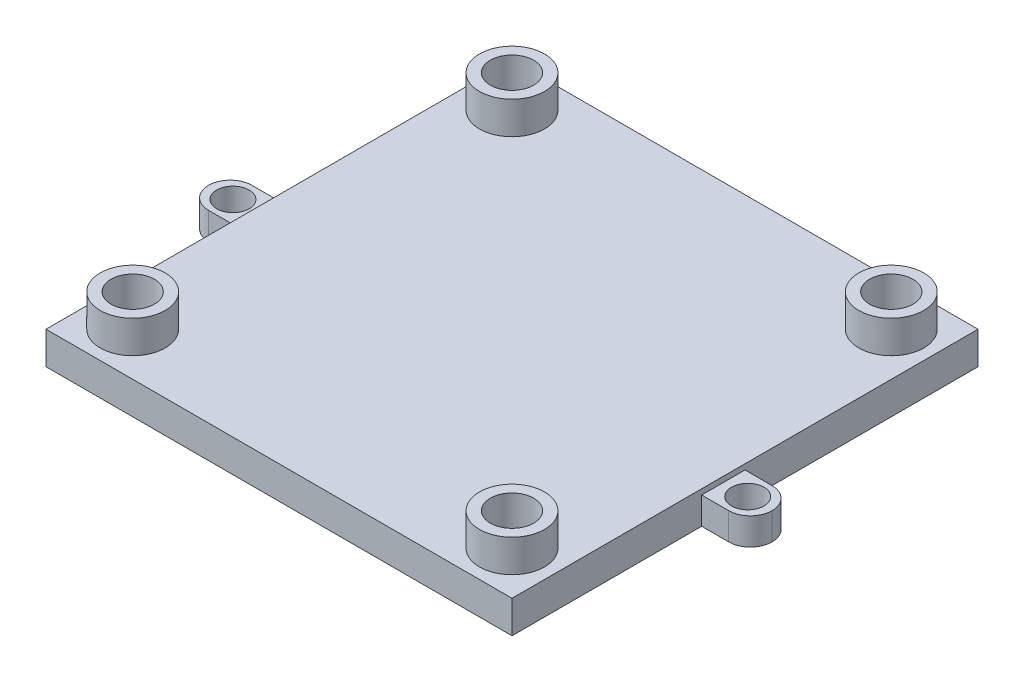
from build123d import *

# Parameters (mm, degrees)
SKETCH1_W            = 43
SKETCH1_H            = 43
BOSS_EXTRUDE1_DEPTH  = 3
SKETCH2_R            = 3
SKETCH2_R_2          = 2
BOSS_EXTRUDE5_DEPTH  = 3
SKETCH2_9_R          = 3
SKETCH2_9_R_2        = 2
BOSS_EXTRUDE6_DEPTH  = 3
SKETCH2_10_R         = 3
SKETCH2_10_R_2       = 2
BOSS_EXTRUDE7_DEPTH  = 3
SKETCH2_11_R         = 3
SKETCH2_11_R_2       = 2
BOSS_EXTRUDE8_DEPTH  = 3
SKETCH3_W            = 4.5
SKETCH3_H            = 4
SKETCH3_R            = 1.5
BOSS_EXTRUDE9_DEPTH  = 2.5
FILLET2_R            = 2
SKETCH4_W            = 4.5
SKETCH4_H            = 4
SKETCH4_R            = 1.5
BOSS_EXTRUDE10_DEPTH = 2.5
FILLET3_R            = 2
SKETCH7_R            = 2
CUT_EXTRUDE1_DEPTH   = 65.142419661
SKETCH2_13_R         = 2
CUT_EXTRUDE2_DEPTH   = 65.142419661
SKETCH2_14_R         = 2
CUT_EXTRUDE3_DEPTH   = 65.142419661


with BuildPart() as part:
    # Sketch1 → Boss-Extrude1 (new body)
    with BuildSketch(Plane(origin=(0, 0, 0), x_dir=(1, 0, 0), z_dir=(0, 1, 0))):
        with Locations((21.5, 21.5)):
            Rectangle(SKETCH1_W, SKETCH1_H)
    extrude(amount=BOSS_EXTRUDE1_DEPTH)

    # Sketch2 → Boss-Extrude5 (add)
    with BuildSketch(Plane(origin=(0, 3, 0), x_dir=(1, 0, 0), z_dir=(0, 1, 0))):
        with Locations(Location((4, 39, 0), (0, 0, 90))):
            Circle(SKETCH2_R)
        with Locations(Location((4, 39, 0), (0, 0, 270))):
            Circle(SKETCH2_R_2, mode=Mode.SUBTRACT)
    extrude(amount=BOSS_EXTRUDE5_DEPTH)

    # Sketch2<9> → Boss-Extrude6 (add)
    with BuildSketch(Plane(origin=(0, 3, 0), x_dir=(1, 0, 0), z_dir=(0, 1, 0))):
        with Locations(Location((39, 39, 0), (0, 0, 90))):
            Circle(SKETCH2_9_R)
        with Locations(Location((39, 39, 0), (0, 0, 270))):
            Circle(SKETCH2_9_R_2, mode=Mode.SUBTRACT)
    extrude(amount=BOSS_EXTRUDE6_DEPTH)

    # Sketch2<10> → Boss-Extrude7 (add)
    with BuildSketch(Plane(origin=(0, 3, 0), x_dir=(1, 0, 0), z_dir=(0, 1, 0))):
        with Locations(Location((4, 4, 0), (0, 0, 90))):
            Circle(SKETCH2_10_R)
        with Locations(Location((4, 4, 0), (0, 0, 270))):
            Circle(SKETCH2_10_R_2, mode=Mode.SUBTRACT)
    extrude(amount=BOSS_EXTRUDE7_DEPTH)

    # Sketch2<11> → Boss-Extrude8 (add)
    with BuildSketch(Plane(origin=(0, 3, 0), x_dir=(1, 0, 0), z_dir=(0, 1, 0))):
        with Locations(Location((39, 4, 0), (0, 0, 90))):
            Circle(SKETCH2_11_R)
        with Locations(Location((39, 4, 0), (0, 0, 270))):
            Circle(SKETCH2_11_R_2, mode=Mode.SUBTRACT)
    extrude(amount=BOSS_EXTRUDE8_DEPTH)

    # Sketch3 → Boss-Extrude9 (add)
    with BuildSketch(Plane.XZ):
        with Locations((-2.25, -19.5)):
            Rectangle(SKETCH3_W, SKETCH3_H)
        with Locations(Location((-2.25, -19.5, 0), (0, 0, 270))):
            Circle(SKETCH3_R, mode=Mode.SUBTRACT)
    extrude(amount=-BOSS_EXTRUDE9_DEPTH)

    # Fillet2
    fillet2_edges = [part.edges().sort_by_distance(p)[0] for p in [
        (-4.5, 1.25, -21.5),
        (-4.5, 1.25, -17.5),
    ]]
    fillet(fillet2_edges, radius=FILLET2_R - 0.0001)  # a hair under: the kernel refuses the full size

    # Sketch4 → Boss-Extrude10 (add)
    with BuildSketch(Plane.XZ):
        with Locations((45.25, -19.5)):
            Rectangle(SKETCH4_W, SKETCH4_H)
        with Locations(Location((45.25, -19.5, 0), (0, 0, 270))):
            Circle(SKETCH4_R, mode=Mode.SUBTRACT)
    extrude(amount=-BOSS_EXTRUDE10_DEPTH)

    # Fillet3
    fillet3_edges = [part.edges().sort_by_distance(p)[0] for p in [
        (47.5, 1.25, -21.5),
        (47.5, 1.25, -17.5),
    ]]
    fillet(fillet3_edges, radius=FILLET3_R - 0.0001)  # a hair under: the kernel refuses the full size

    # Sketch7 → Cut-Extrude1 (cut, through all)
    with BuildSketch(Plane(origin=(0, 3, 0), x_dir=(1, 0, 0), z_dir=(0, 1, 0))):
        with Locations(Location((4, 39, 0), (0, 0, 270))):
            Circle(SKETCH7_R)
    extrude(amount=-CUT_EXTRUDE1_DEPTH, mode=Mode.SUBTRACT)

    # Sketch2<13> → Cut-Extrude2 (cut, through all)
    with BuildSketch(Plane(origin=(0, 3, 0), x_dir=(1, 0, 0), z_dir=(0, 1, 0))):
        with Locations(Location((39, 39, 0), (0, 0, 270))):
            Circle(SKETCH2_13_R)
    extrude(amount=-CUT_EXTRUDE2_DEPTH, mode=Mode.SUBTRACT)

    # Sketch2<14> → Cut-Extrude3 (cut, through all)
    with BuildSketch(Plane(origin=(0, 3, 0), x_dir=(1, 0, 0), z_dir=(0, 1, 0))):
        with Locations(Location((4, 4, 0), (0, 0, 270))):
            Circle(SKETCH2_14_R)
        with Locations(Location((39, 4, 0), (0, 0, 270))):
            Circle(SKETCH2_14_R)
    extrude(amount=-CUT_EXTRUDE3_DEPTH, mode=Mode.SUBTRACT)


solid = part.part
